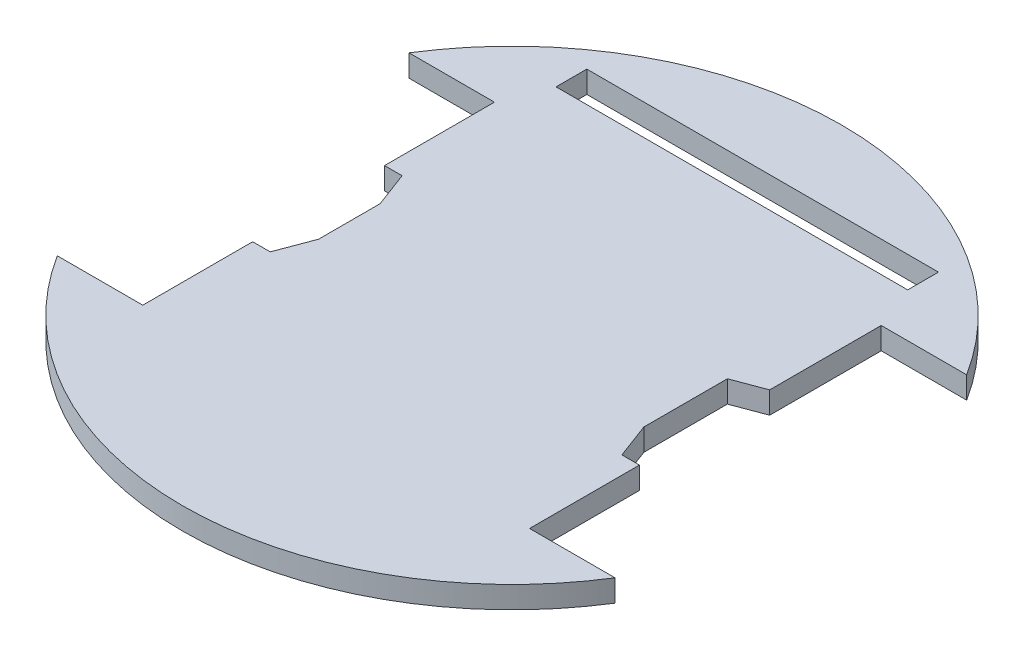
from build123d import *

# Parameters (mm, degrees)
SKETCH1_W           = 80
SKETCH1_H           = 7
BOSS_EXTRUDE1_DEPTH = 5
CHAMFER1_SIZE       = 8
CHAMFER1_SIZE_2     = 3


with BuildPart() as part:
    # Sketch1 → Boss-Extrude1 (new body)
    with BuildSketch(Plane(origin=(0, 0, 0), x_dir=(1, 0, 0), z_dir=(0, 1, 0))):
        with BuildLine():
            Line((-44, -40), (-44, -15))
            Line((-44, -15), (-37, -15))
            Line((-37, -15), (-37, 15))
            Line((-37, 15), (-44, 15))
            Line((-44, 15), (-44, 40))
            Line((-44, 40), (-63.442887702, 40))
            ThreePointArc((-63.442887702, 40), (0, 75), (63.442887702, 40))
            Line((63.442887702, 40), (44, 40))
            Line((44, 40), (44, 15))
            Line((44, 15), (37, 15))
            Line((37, 15), (37, -15))
            Line((37, -15), (44, -15))
            Line((44, -15), (44, -40))
            Line((44, -40), (63.442887702, -40))
            ThreePointArc((63.442887702, -40), (0, -75), (-63.442887702, -40))
            Line((-63.442887702, -40), (-44, -40))
        make_face()
        with Locations((0, 53.524444958)):
            Rectangle(SKETCH1_W, SKETCH1_H, mode=Mode.SUBTRACT)
    extrude(amount=BOSS_EXTRUDE1_DEPTH)

    # Chamfer1
    # the kernel refuses this chamfer: 8, 3 mm, written as the material it adds along each edge
    with BuildSketch(Plane(origin=(37, 0, 15), x_dir=(-0.013536660009854304, 0, -0.9999083752203387), z_dir=(0, 1, 0)), Plane(origin=(-37, 0, -15), x_dir=(0.013536660009854304, 0, 0.9999083752203387), z_dir=(0, 1, 0))) as chamfer1_piece_1:
        Polygon((CHAMFER1_SIZE * 0.99990837522, -CHAMFER1_SIZE * 0.0135366600099), (-CHAMFER1_SIZE_2 * 0.0135366600099, -CHAMFER1_SIZE_2 * 0.99990837522), (0, 0), align=None)
    extrude(amount=5)
    with BuildSketch(Plane(origin=(37, 0, -15), x_dir=(0.9999083752203387, 0, -0.013536660009854514), z_dir=(0, 1, 0))) as chamfer1_piece_2_section:
        Polygon((CHAMFER1_SIZE * 0.99990837522, -CHAMFER1_SIZE * 0.0135366600099), (-CHAMFER1_SIZE_2 * 0.0135366600099, -CHAMFER1_SIZE_2 * 0.99990837522), (0, 0), align=None)
    chamfer1_piece_2 = extrude(amount=5, mode=Mode.PRIVATE)
    chamfer1_piece_2 = split(chamfer1_piece_2, bisect_by=Plane(origin=(44, 2.5, -14.03968053), z_dir=(-1, 0, 0)), keep=Keep.TOP, mode=Mode.PRIVATE)
    add(chamfer1_piece_2)
    with BuildSketch(Plane(origin=(-37, 0, 15), x_dir=(-0.9953980532473654, 0, 0.09582648689874379), z_dir=(0, 1, 0))) as chamfer1_piece_3:
        Polygon((CHAMFER1_SIZE_2 * 0.995398053247, -CHAMFER1_SIZE_2 * 0.0958264868987), (-CHAMFER1_SIZE * 0.0958264868987, -CHAMFER1_SIZE * 0.995398053247), (0, 0), align=None)
    extrude(amount=5)


solid = part.part
